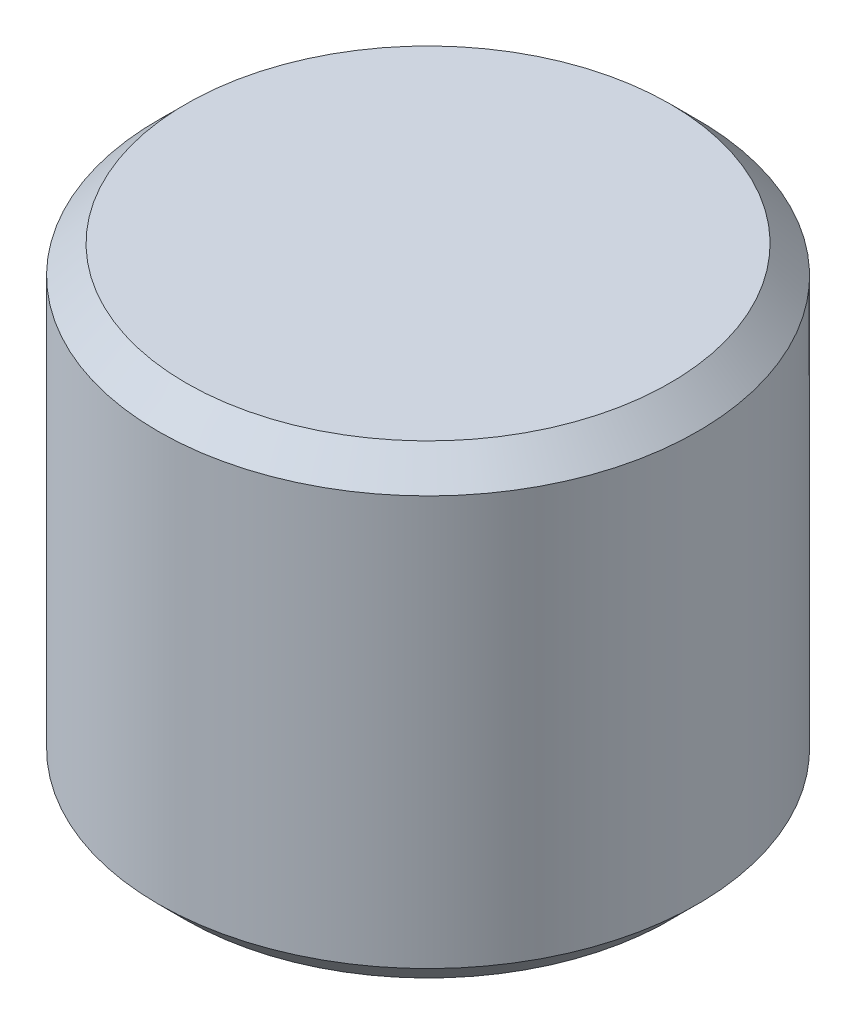
from build123d import *

# Parameters (mm, degrees)
SKETCH_1_R      = 14.5
EXTRUDE_1_DEPTH = 25
CHAMFER_1_SIZE  = 1.5


with BuildPart() as part:
    # 草图1 → 凸台-拉伸1 (new body)
    with BuildSketch(Plane(origin=(0, 0, 0), x_dir=(1, 0, 0), z_dir=(0, 1, 0))):
        Circle(SKETCH_1_R)
    extrude(amount=EXTRUDE_1_DEPTH)

    # 倒角1
    chamfer_1_edges = [part.edges().sort_by_distance(p)[0] for p in [
        (-14.5, 0, 0),
        (-14.5, 25, 0),
    ]]
    chamfer(chamfer_1_edges, length=CHAMFER_1_SIZE)


solid = part.part
